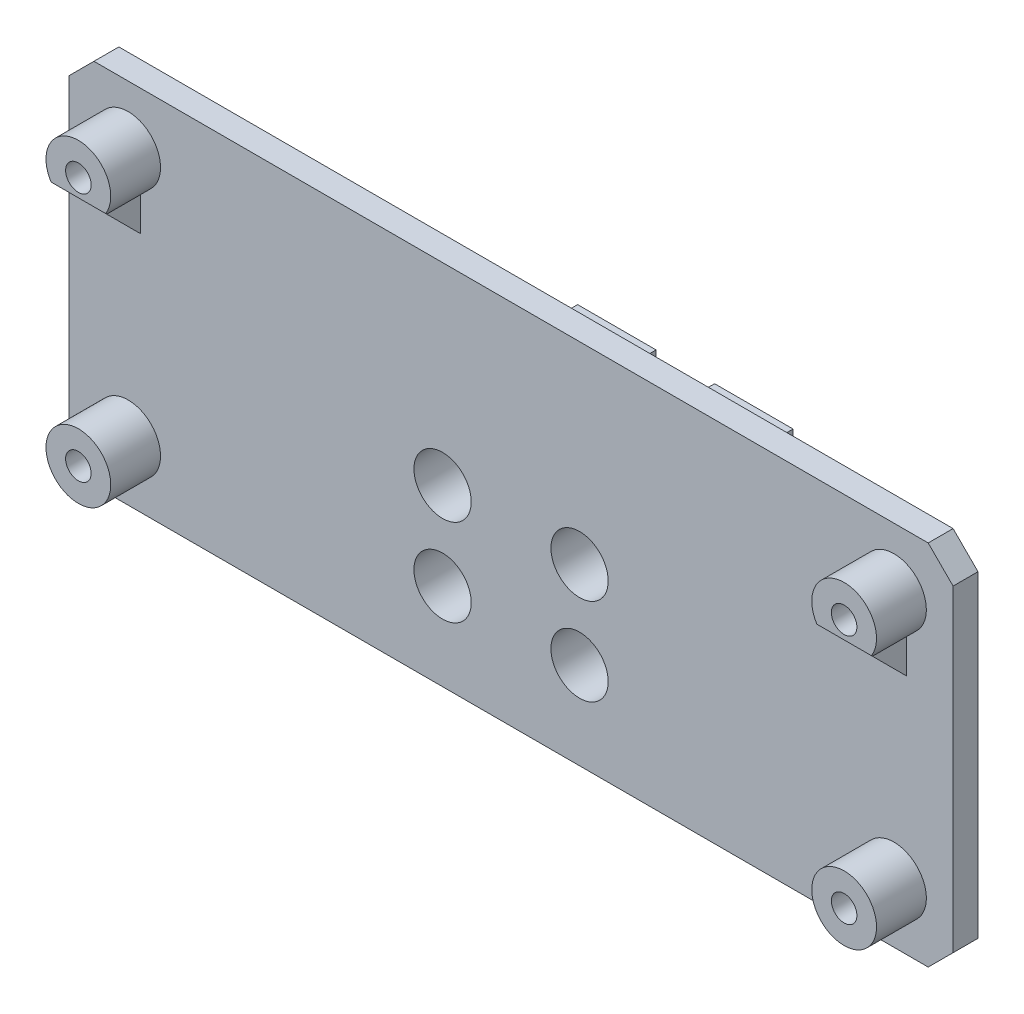
from build123d import *

# Parameters (mm, degrees)
BOSS_EXTRUDE1_DEPTH = 2
SKETCH5_R           = 2.6
BOSS_EXTRUDE4_DEPTH = 4
SKETCH6_R           = 1.025
CUT_EXTRUDE1_DEPTH  = 39.907743445
BOSS_EXTRUDE6_DEPTH = 4
CHAMFER1_SIZE       = 5
SKETCH8_W           = 6.3
SKETCH8_H           = 18
BOSS_EXTRUDE8_DEPTH = 12
SKETCH9_R           = 1.05
CUT_EXTRUDE3_DEPTH  = 41.912253666
SKETCH10_R          = 2.3
CUT_EXTRUDE4_DEPTH  = 12.5


with BuildPart() as part:
    # Sketch1 → Boss-Extrude1 (new body)
    with BuildSketch(Plane.XY):
        Polygon((-33.5, 14.75), (-35.5, 12.75), (-35.5, -12.75), (-33.5, -14.75), (33.5, -14.75), (35.5, -12.75), (35.5, 12.75), (33.5, 14.75), align=None)
    extrude(amount=BOSS_EXTRUDE1_DEPTH)

    # Sketch5 → Boss-Extrude4 (add)
    with BuildSketch(Plane.XY.offset(2)):
        with Locations(Location((-30.75, 10.03, 0), (0, 0, 180))):
            Circle(SKETCH5_R)
        with Locations(Location((30.75, 10.03, 0), (0, 0, 180))):
            Circle(SKETCH5_R)
        with Locations(Location((30.75, -10.03, 0), (0, 0, 180))):
            Circle(SKETCH5_R)
        with Locations(Location((-30.75, -10.03, 0), (0, 0, 180))):
            Circle(SKETCH5_R)
    extrude(amount=BOSS_EXTRUDE4_DEPTH)

    # Sketch6 → Cut-Extrude1 (cut, through all)
    with BuildSketch(Plane.XY.offset(6)):
        with Locations((-30.75, 10.03)):
            Circle(SKETCH6_R)
        with Locations(Location((30.75, 10.03, 0), (0, 0, 180))):
            Circle(SKETCH6_R)
        with Locations((30.75, -10.03)):
            Circle(SKETCH6_R)
        with Locations(Location((-30.75, -10.03, 0), (0, 0, 180))):
            Circle(SKETCH6_R)
    extrude(amount=-CUT_EXTRUDE1_DEPTH, mode=Mode.SUBTRACT)

    # Sketch7 → Boss-Extrude6 (add)
    with BuildSketch(Plane.XY.offset(2)):
        with BuildLine():
            Line((-31.75, 7.63), (-31.75, 3.63))
            Line((-31.75, 3.63), (-29.75, 3.63))
            Line((-29.75, 3.63), (-29.75, 7.63))
            ThreePointArc((-29.75, 7.63), (-30.75, 7.43), (-31.75, 7.63))
        make_face()
        with BuildLine():
            Line((29.75, 7.63), (29.75, 3.63))
            Line((29.75, 3.63), (31.75, 3.63))
            Line((31.75, 3.63), (31.75, 7.63))
            ThreePointArc((31.75, 7.63), (30.75, 7.43), (29.75, 7.63))
        make_face()
    extrude(amount=BOSS_EXTRUDE6_DEPTH)

    # Chamfer1
    # the kernel refuses this chamfer: 5 mm, written as the material it takes off along each edge
    with BuildSketch(Plane(origin=(16.89158506, 3.63, 6), x_dir=(0, 0.9996219169112968, 0.027495876610586317), z_dir=(1, 0, 0))) as chamfer1_piece_1_section:
        Polygon((CHAMFER1_SIZE * 0.999621916911, -CHAMFER1_SIZE * 0.0274958766106), (-CHAMFER1_SIZE * 0.0274958766106, -CHAMFER1_SIZE * 0.999621916911), (0, 0), align=None)
    chamfer1_piece_1 = extrude(amount=27.71682988, mode=Mode.PRIVATE)
    chamfer1_piece_1 = split(chamfer1_piece_1, bisect_by=Plane(origin=(30.75, 5.358592062, 2), z_dir=(0, 0, 1)), keep=Keep.TOP, mode=Mode.PRIVATE)
    add(chamfer1_piece_1, mode=Mode.SUBTRACT)
    with BuildSketch(Plane(origin=(-44.60841494, 3.63, 6), x_dir=(0, 0.9996219169112968, 0.027495876610586317), z_dir=(1, 0, 0))) as chamfer1_piece_2_section:
        Polygon((CHAMFER1_SIZE * 0.999621916911, -CHAMFER1_SIZE * 0.0274958766106), (-CHAMFER1_SIZE * 0.0274958766106, -CHAMFER1_SIZE * 0.999621916911), (0, 0), align=None)
    chamfer1_piece_2 = extrude(amount=27.71682988, mode=Mode.PRIVATE)
    chamfer1_piece_2 = split(chamfer1_piece_2, bisect_by=Plane(origin=(-30.75, 5.358592062, 2), z_dir=(0, 0, 1)), keep=Keep.TOP, mode=Mode.PRIVATE)
    add(chamfer1_piece_2, mode=Mode.SUBTRACT)

    # Sketch8 → Boss-Extrude8 (add)
    with BuildSketch(Plane(origin=(0, 0, 0), x_dir=(-1, 0, 0), z_dir=(0, 0, -1))):
        with Locations((-5.5, -5.75)):
            Rectangle(SKETCH8_W, SKETCH8_H)
        with Locations((5.5, -5.75)):
            Rectangle(SKETCH8_W, SKETCH8_H)
    extrude(amount=BOSS_EXTRUDE8_DEPTH)

    # Sketch9 → Cut-Extrude3 (cut, through all)
    with BuildSketch(Plane.XY.offset(2)):
        with Locations((5.5, -7.75)):
            Circle(SKETCH9_R)
        with Locations((5.5, -0.75)):
            Circle(SKETCH9_R)
        with Locations(Location((-5.5, -0.75, 0), (0, 0, 180))):
            Circle(SKETCH9_R)
        with Locations(Location((-5.5, -7.75, 0), (0, 0, 180))):
            Circle(SKETCH9_R)
    extrude(amount=-CUT_EXTRUDE3_DEPTH, mode=Mode.SUBTRACT)

    # Sketch10 → Cut-Extrude4 (cut)
    with BuildSketch(Plane.XY.offset(2)):
        with Locations((5.5, -7.75)):
            Circle(SKETCH10_R)
        with Locations((5.5, -0.75)):
            Circle(SKETCH10_R)
        with Locations(Location((-5.5, -0.75, 0), (0, 0, 180))):
            Circle(SKETCH10_R)
        with Locations(Location((-5.5, -7.75, 0), (0, 0, 180))):
            Circle(SKETCH10_R)
    extrude(amount=-CUT_EXTRUDE4_DEPTH, mode=Mode.SUBTRACT)


solid = part.part
